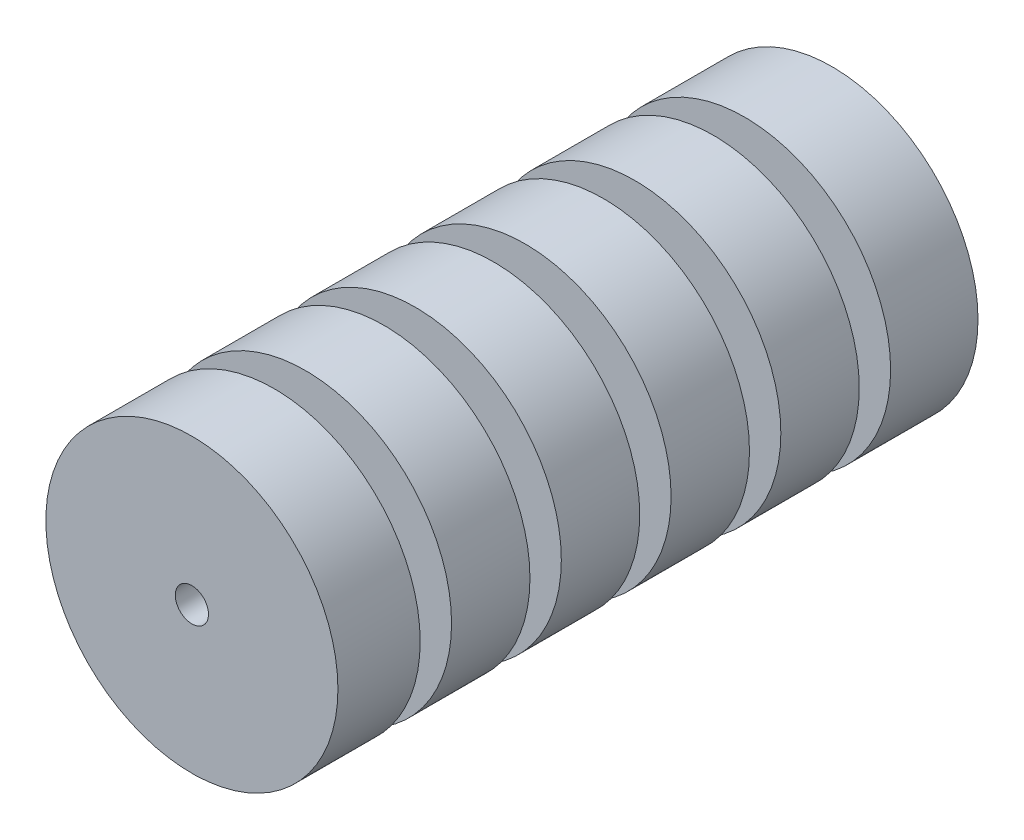
from build123d import *

# Parameters (mm, degrees)
SKETCH3_R            = 27.94
BOSS_EXTRUDE2_DEPTH  = 122.46
SKETCH5_R            = 3.175
CUT_EXTRUDE1_DEPTH   = 129.676877488
SKETCH4_W            = 14
SKETCH4_H            = 6
SHELL1_START         = 3
SHELL1_OUTLINE_R     = 10.94
SHELL1_OUTLINE_R_2   = 6.175
SHELL1_DEPTH         = 116.46
SHELL1_2_OUTLINE_R   = 24.94
SHELL1_2_OUTLINE_R_2 = 10.94
SHELL1_2_DEPTH       = 10.72
SHELL1_START_2       = 109.72
SHELL1_3_OUTLINE_R   = 24.94
SHELL1_3_OUTLINE_R_2 = 10.94
SHELL1_3_DEPTH       = 9.74
SHELL1_START_3       = 25.72
SHELL1_4_OUTLINE_R   = 24.94
SHELL1_4_OUTLINE_R_2 = 10.94
SHELL1_4_DEPTH       = 9
SHELL1_START_4       = 46.72
SHELL1_5_OUTLINE_R   = 24.94
SHELL1_5_OUTLINE_R_2 = 10.94
SHELL1_5_DEPTH       = 9
SHELL1_START_5       = 67.72
SHELL1_6_OUTLINE_R   = 24.94
SHELL1_6_OUTLINE_R_2 = 10.94
SHELL1_6_DEPTH       = 9
SHELL1_START_6       = 88.72
SHELL1_7_OUTLINE_R   = 24.94
SHELL1_7_OUTLINE_R_2 = 10.94
SHELL1_7_DEPTH       = 9
BOSS_EXTRUDE3_START  = -119.46
BOSS_EXTRUDE3_DEPTH  = 116.46
SKETCH13_W           = 16.483162312
SKETCH13_H           = 6


# Read off the part's stored shape, not the designer's step: Shell1, Boss-Extrude3
with BuildPart() as part:
    # Sketch3 → Boss-Extrude2 (new body)
    with BuildSketch(Plane.XY):
        Circle(SKETCH3_R)
    extrude(amount=BOSS_EXTRUDE2_DEPTH)

    # Sketch5 → Cut-Extrude1 (cut, through all)
    with BuildSketch(Plane.XY.offset(122.46)):
        Circle(SKETCH5_R)
    extrude(amount=-CUT_EXTRUDE1_DEPTH, mode=Mode.SUBTRACT)

    # Sketch4 → Cut-Revolve1 (revolve, cut)
    with BuildSketch(Plane(origin=(0, 0, 0), x_dir=(1, 0, 0), z_dir=(0, 1, 0)), mode=Mode.PRIVATE) as cut_revolve1_sk:
        with Locations((-20.94, -103.72)):
            Rectangle(SKETCH4_W, SKETCH4_H)
        with Locations((-20.94, -82.72)):
            Rectangle(SKETCH4_W, SKETCH4_H)
        with Locations((-20.94, -61.72)):
            Rectangle(SKETCH4_W, SKETCH4_H)
        with Locations((-20.94, -40.72)):
            Rectangle(SKETCH4_W, SKETCH4_H)
        with Locations((-20.94, -19.72)):
            Rectangle(SKETCH4_W, SKETCH4_H)
    revolve(cut_revolve1_sk.sketch.rotate(Axis((0, 0, 122.46), (0, 0, -1)), 180), axis=Axis((0, 0, 122.46), (0, 0, -1)), mode=Mode.SUBTRACT)

    # Shell1 outline → Shell1 (cut)
    with BuildSketch(Plane.XY.offset(SHELL1_START)):
        Circle(SHELL1_OUTLINE_R)
        Circle(SHELL1_OUTLINE_R_2, mode=Mode.SUBTRACT)
    extrude(amount=SHELL1_DEPTH, mode=Mode.SUBTRACT)

    # Shell1 2 outline → Shell1 2 (cut)
    with BuildSketch(Plane.XY.offset(SHELL1_START)):
        Circle(SHELL1_2_OUTLINE_R)
        Circle(SHELL1_2_OUTLINE_R_2, mode=Mode.SUBTRACT)
    extrude(amount=SHELL1_2_DEPTH, mode=Mode.SUBTRACT)

    # Shell1 3 outline → Shell1 3 (cut)
    with BuildSketch(Plane.XY.offset(SHELL1_START_2)):
        Circle(SHELL1_3_OUTLINE_R)
        Circle(SHELL1_3_OUTLINE_R_2, mode=Mode.SUBTRACT)
    extrude(amount=SHELL1_3_DEPTH, mode=Mode.SUBTRACT)

    # Shell1 4 outline → Shell1 4 (cut)
    with BuildSketch(Plane.XY.offset(SHELL1_START_3)):
        Circle(SHELL1_4_OUTLINE_R)
        Circle(SHELL1_4_OUTLINE_R_2, mode=Mode.SUBTRACT)
    extrude(amount=SHELL1_4_DEPTH, mode=Mode.SUBTRACT)

    # Shell1 5 outline → Shell1 5 (cut)
    with BuildSketch(Plane.XY.offset(SHELL1_START_4)):
        Circle(SHELL1_5_OUTLINE_R)
        Circle(SHELL1_5_OUTLINE_R_2, mode=Mode.SUBTRACT)
    extrude(amount=SHELL1_5_DEPTH, mode=Mode.SUBTRACT)

    # Shell1 6 outline → Shell1 6 (cut)
    with BuildSketch(Plane.XY.offset(SHELL1_START_5)):
        Circle(SHELL1_6_OUTLINE_R)
        Circle(SHELL1_6_OUTLINE_R_2, mode=Mode.SUBTRACT)
    extrude(amount=SHELL1_6_DEPTH, mode=Mode.SUBTRACT)

    # Shell1 7 outline → Shell1 7 (cut)
    with BuildSketch(Plane.XY.offset(SHELL1_START_6)):
        Circle(SHELL1_7_OUTLINE_R)
        Circle(SHELL1_7_OUTLINE_R_2, mode=Mode.SUBTRACT)
    extrude(amount=SHELL1_7_DEPTH, mode=Mode.SUBTRACT)

    # Boss-Extrude3 outline → Boss-Extrude3 (add)
    with BuildSketch(Plane(origin=(0, 0, 0), x_dir=(-1, 0, 0), z_dir=(0, 0, -1)).offset(BOSS_EXTRUDE3_START)):
        with BuildLine():
            ThreePointArc((1, 27.922098775), (0, 27.94), (-1, 27.922098775))
            Line((-1, 27.922098775), (-1, 6.093490379))
            ThreePointArc((-1, 6.093490379), (0, 6.175), (1, 6.093490379))
            Line((1, 6.093490379), (1, 27.922098775))
        make_face()
        with BuildLine():
            Line((-27.922098775, -1), (-6.093490379, -1))
            ThreePointArc((-6.093490379, -1), (-6.175, 0), (-6.093490379, 1))
            Line((-6.093490379, 1), (-27.922098775, 1))
            ThreePointArc((-27.922098775, 1), (-27.94, 0), (-27.922098775, -1))
        make_face()
        with BuildLine():
            ThreePointArc((27.922098775, -1), (27.94, 0), (27.922098775, 1))
            Line((27.922098775, 1), (6.093490379, 1))
            ThreePointArc((6.093490379, 1), (6.175, 0), (6.093490379, -1))
            Line((6.093490379, -1), (27.922098775, -1))
        make_face()
        with BuildLine():
            Line((1, -27.922098775), (1, -6.093490379))
            ThreePointArc((1, -6.093490379), (0, -6.175), (-1, -6.093490379))
            Line((-1, -6.093490379), (-1, -27.922098775))
            ThreePointArc((-1, -27.922098775), (0, -27.94), (1, -27.922098775))
        make_face()
    extrude(amount=BOSS_EXTRUDE3_DEPTH)

    # Sketch13 → Cut-Revolve2 (revolve, cut)
    with BuildSketch(Plane(origin=(0, 0, 0), x_dir=(1, 0, 0), z_dir=(0, 1, 0)), mode=Mode.PRIVATE) as cut_revolve2_sk:
        with Locations((-22.145666886, -40.72)):
            Rectangle(SKETCH13_W, SKETCH13_H)
        with Locations((-22.145666886, -19.72)):
            Rectangle(SKETCH13_W, SKETCH13_H)
        with Locations((-22.145666886, -61.72)):
            Rectangle(SKETCH13_W, SKETCH13_H)
        with Locations((-22.145666886, -82.72)):
            Rectangle(SKETCH13_W, SKETCH13_H)
        with Locations((-22.145666886, -103.72)):
            Rectangle(SKETCH13_W, SKETCH13_H)
    revolve(cut_revolve2_sk.sketch.rotate(Axis((0, 0, 121.588746248), (0, 0, -1)), 180), axis=Axis((0, 0, 121.588746248), (0, 0, -1)), mode=Mode.SUBTRACT)


solid = part.part
